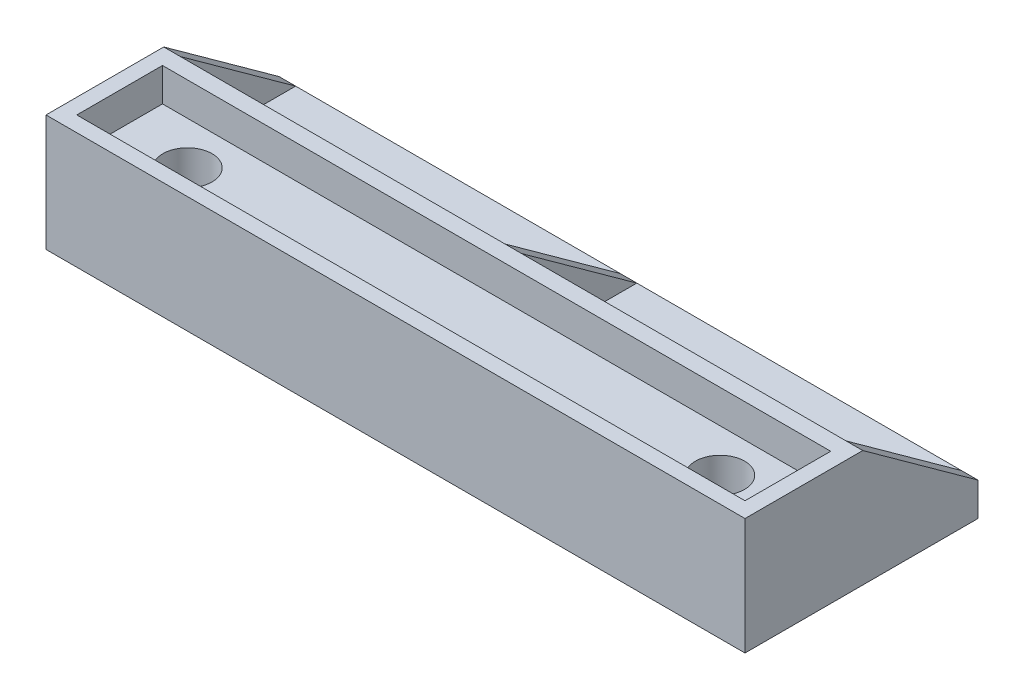
from build123d import *

# Parameters (mm, degrees)
SKETCH1_W               = 42
SKETCH1_H               = 7
RISER_DEPTH             = 7
SKETCH2_R               = 1.475
MOUNTING_HOLES_DEPTH    = 44.150898021
SKETCH3_W               = 40.15
SKETCH3_H               = 5.15
RECESS_DEPTH            = 2
SKETCH4_W               = 42
SKETCH4_H               = 7
FLANGE_DEPTH            = 7
SKETCH5_W               = 19.5
SKETCH5_H               = 6.925
FLANGE_CUTOUT_DEPTH     = 5
ANGLE_CUTOUT_DEPTH      = 27.594172294
ANGLE_CUTOUT_DEPTH_BACK = 27.594172294
FLANGE_CHAMFER_1_SIZE   = 1
FLANGE_CHAMFER_2_SIZE   = 1


with BuildPart() as part:
    # Sketch1 → Riser (new body)
    with BuildSketch(Plane(origin=(0, 0, 0), x_dir=(1, 0, 0), z_dir=(0, 1, 0))):
        with Locations((21, 3.5)):
            Rectangle(SKETCH1_W, SKETCH1_H)
    extrude(amount=RISER_DEPTH)

    # Sketch2 → Mounting Holes (cut, through all)
    with BuildSketch(Plane.XZ):
        with Locations((5, -3.5)):
            Circle(SKETCH2_R)
        with Locations((37, -3.5)):
            Circle(SKETCH2_R)
    extrude(amount=-MOUNTING_HOLES_DEPTH, mode=Mode.SUBTRACT)

    # Sketch3 → Recess (cut)
    with BuildSketch(Plane(origin=(0, 7, 0), x_dir=(1, 0, 0), z_dir=(0, 1, 0))):
        with Locations((21, 3.5)):
            Rectangle(SKETCH3_W, SKETCH3_H)
    extrude(amount=-RECESS_DEPTH, mode=Mode.SUBTRACT)

    # Sketch4 → Flange (add)
    with BuildSketch(Plane(origin=(0, 0, 0), x_dir=(1, 0, 0), z_dir=(0, 1, 0))):
        with Locations((21, 10.5)):
            Rectangle(SKETCH4_W, SKETCH4_H)
    extrude(amount=FLANGE_DEPTH)

    # Sketch5 → Flange Cutout (cut)
    with BuildSketch(Plane(origin=(0, 7, 0), x_dir=(1, 0, 0), z_dir=(0, 1, 0))):
        with Locations((10.75, 10.5375)):
            Rectangle(SKETCH5_W, SKETCH5_H)
        with Locations((31.25, 10.5375)):
            Rectangle(SKETCH5_W, SKETCH5_H)
    extrude(amount=-FLANGE_CUTOUT_DEPTH, mode=Mode.SUBTRACT)

    # Sketch7 → Angle Cutout (cut, two sides: drawn at the far end of the back side and taken through both)
    with BuildSketch(Plane.ZY.offset(-20.5).offset(-ANGLE_CUTOUT_DEPTH_BACK)):
        Polygon((-7.075, 7), (-14, 2), (-14, 7), align=None)
    extrude(amount=ANGLE_CUTOUT_DEPTH + ANGLE_CUTOUT_DEPTH_BACK, mode=Mode.SUBTRACT)

    # Flange Chamfer 1
    flange_chamfer_1_edges = [part.edges().sort_by_distance(p)[0] for p in [
        (10.75, 2, -7.075),
    ]]
    chamfer(flange_chamfer_1_edges, length=FLANGE_CHAMFER_1_SIZE)

    # Flange Chamfer 2
    flange_chamfer_2_edges = [part.edges().sort_by_distance(p)[0] for p in [
        (31.25, 2, -7.075),
    ]]
    chamfer(flange_chamfer_2_edges, length=FLANGE_CHAMFER_2_SIZE)


solid = part.part
